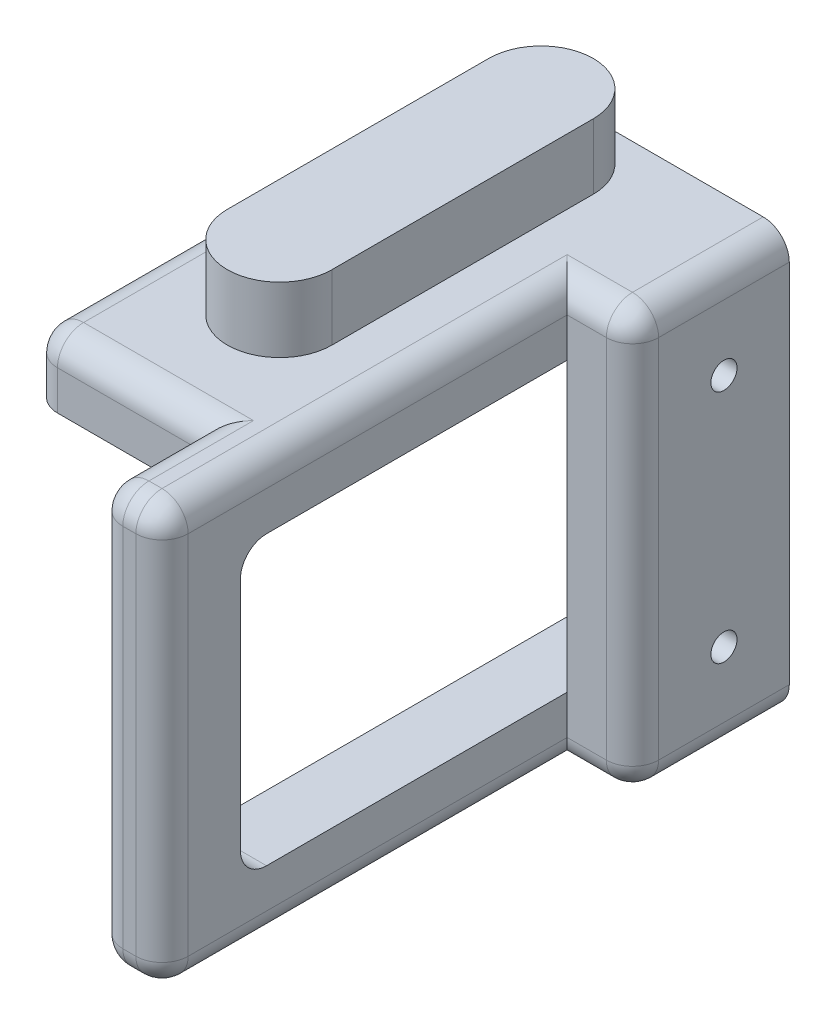
from build123d import *

# Parameters (mm, degrees)
BOSS_EXTRUDE1_DEPTH = 5
SKETCH2_W           = 12
SKETCH2_H           = 32
BOSS_EXTRUDE2_DEPTH = 5
CUT_EXTRUDE1_REACH  = 53.749
SKETCH3_R           = 1
FILLET1_R           = 2
SKETCH5_W           = 35
SKETCH5_H           = 5
BOSS_EXTRUDE3_DEPTH = 13
FILLET2_R           = 2
FILLET3_R           = 2
FILLET4_R           = 2
BOSS_EXTRUDE4_DEPTH = 5


with BuildPart() as part:
    # Sketch1 → Boss-Extrude1 (new body)
    with BuildSketch(Plane(origin=(0, 0, 0), x_dir=(0, 0, -1), z_dir=(1, 0, 0))):
        with BuildLine():
            Line((0, 22), (0, 27))
            Line((0, 27), (-41, 27))
            ThreePointArc((-41, 27), (-42.414213562, 26.414213562), (-43, 25))
            Line((-43, 25), (-43, -3))
            ThreePointArc((-43, -3), (-42.414213562, -4.414213562), (-41, -5))
            Line((-41, -5), (0, -5))
            Line((0, -5), (0, 0))
            Line((0, 0), (-35, 0))
            ThreePointArc((-35, 0), (-36.414213562, 0.585786438), (-37, 2))
            Line((-37, 2), (-37, 20))
            ThreePointArc((-37, 20), (-36.414213562, 21.414213562), (-35, 22))
            Line((-35, 22), (0, 22))
        make_face()
    extrude(amount=-BOSS_EXTRUDE1_DEPTH)

    # Sketch2 → Boss-Extrude2 (add)
    with BuildSketch(Plane(origin=(0, 0, 0), x_dir=(0, 0, -1), z_dir=(1, 0, 0))):
        with Locations((-6, 11)):
            Rectangle(SKETCH2_W, SKETCH2_H)
    extrude(amount=BOSS_EXTRUDE2_DEPTH)

    # Sketch3 → Cut-Extrude1 (cut, up to next)
    with BuildSketch(Plane(origin=(5, 0, 0), x_dir=(0, 0, -1), z_dir=(1, 0, 0)), mode=Mode.PRIVATE) as cut_extrude1_sk1:
        with Locations((-5, 2)):
            Circle(SKETCH3_R)
    cut_extrude1_tool1 = extrude(cut_extrude1_sk1.sketch, amount=-CUT_EXTRUDE1_REACH, mode=Mode.PRIVATE) & part.part
    # Sketch3 → Cut-Extrude1 (cut, up to next)
    with BuildSketch(Plane(origin=(5, 0, 0), x_dir=(0, 0, -1), z_dir=(1, 0, 0)), mode=Mode.PRIVATE) as cut_extrude1_sk2:
        with Locations((-5, 20)):
            Circle(SKETCH3_R)
    cut_extrude1_tool2 = extrude(cut_extrude1_sk2.sketch, amount=-CUT_EXTRUDE1_REACH, mode=Mode.PRIVATE) & part.part
    add(cut_extrude1_tool1.solids().sort_by_distance((5, 2, 5))[0], mode=Mode.SUBTRACT)
    add(cut_extrude1_tool2.solids().sort_by_distance((5, 20, 5))[0], mode=Mode.SUBTRACT)

    # Fillet1
    fillet1_edges = [part.edges().sort_by_distance(p)[0] for p in [
        (5, 27, 6),
        (5, -5, 6),
    ]]
    fillet(fillet1_edges, radius=FILLET1_R)

    # Sketch5 → Boss-Extrude3 (add)
    with BuildSketch(Plane.ZY.offset(5)):
        with Locations((17.5, 24.5)):
            Rectangle(SKETCH5_W, SKETCH5_H)
    extrude(amount=BOSS_EXTRUDE3_DEPTH)

    # Fillet2
    fillet2_edges = [part.edges().sort_by_distance(p)[0] for p in [
        (-18, 24.5, 35),
    ]]
    fillet(fillet2_edges, radius=FILLET2_R)

    # Fillet3
    fillet3_edges = [part.edges().sort_by_distance(p)[0] for p in [
        (-5, 27, 38),
        (-5, 26.414213562, 42.414213562),
        (-5, 11, 43),
        (-5, -5, 20.5),
        (0, 27, 26.5),
        (0, 26.414213562, 42.414213562),
        (0, 11, 43),
        (0, -5, 26.5),
        (1.5, 27, 12),
        (4.414213562, 26.414213562, 12),
        (1.5, -5, 12),
        (4.414213562, -4.414213562, 12),
        (-5, -4.414213562, 42.414213562),
        (0, -4.414213562, 42.414213562),
        (5, 11, 12),
    ]]
    fillet(fillet3_edges, radius=FILLET3_R)

    # Fillet4
    fillet4_edges = [part.edges().sort_by_distance(p)[0] for p in [
        (-18, 27, 16.5),
        (-17.414213562, 27, 34.414213562),
        (-9.5, 27, 35),
    ]]
    fillet(fillet4_edges, radius=FILLET4_R)

    # Encastre → Boss-Extrude4 (add)
    with BuildSketch(Plane(origin=(0, 27, 0), x_dir=(1, 0, 0), z_dir=(0, 1, 0))):
        with BuildLine():
            Line((-5, -5), (-5, -25))
            ThreePointArc((-5, -25), (-9, -29), (-13, -25))
            Line((-13, -25), (-13, -5))
            ThreePointArc((-13, -5), (-9, -1), (-5, -5))
        make_face()
    extrude(amount=BOSS_EXTRUDE4_DEPTH)


solid = part.part
